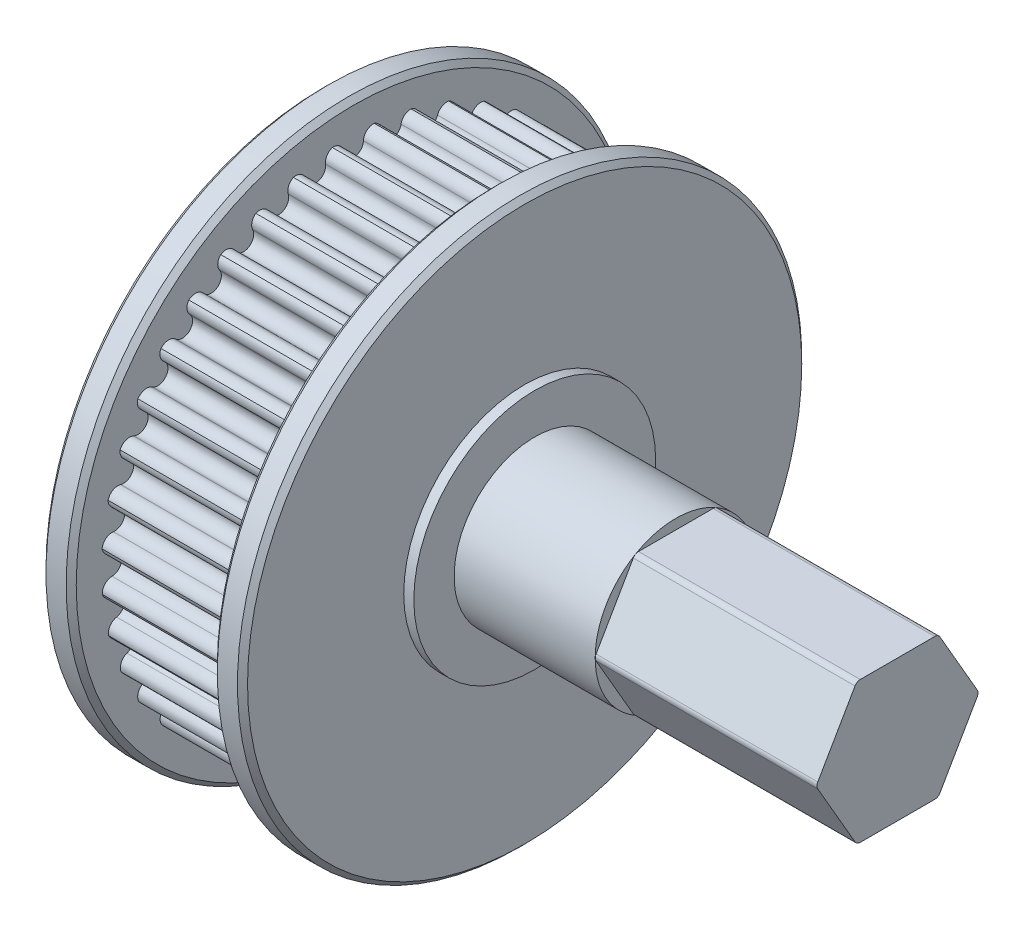
from build123d import *

# Parameters (mm, degrees)
CUT_EXTRUDE1_START       = -16.5
CUT_EXTRUDE1_OUTLINE_R   = 4
CUT_EXTRUDE1_DEPTH       = 9.5
CUT_EXTRUDE1_START_2     = -16.75
CUT_EXTRUDE1_2_OUTLINE_R = 14
CUT_EXTRUDE1_2_DEPTH     = 1
CUT_EXTRUDE1_START_3     = -8.25
CUT_EXTRUDE1_3_OUTLINE_R = 14
CUT_EXTRUDE1_3_DEPTH     = 1
BOSS_EXTRUDE1_START      = -10
SKETCH2_R                = 6.324330015
BOSS_EXTRUDE1_DEPTH      = 10
SKETCH3_R                = 11.125
CUT_EXTRUDE2_DEPTH       = 7
BOSS_EXTRUDE2_START      = 0.5
SKETCH4_R                = 11.125
SKETCH4_R_2              = 9.625
BOSS_EXTRUDE2_DEPTH      = 0.5
SKETCH7_R                = 6
BOSS_EXTRUDE5_DEPTH      = 0.5
SKETCH5_R                = 4
BOSS_EXTRUDE3_DEPTH      = 7
BOSS_EXTRUDE4_DEPTH      = 11


with BuildPart() as part:
    # Cut-Extrude1: read off the stored shape, not the designer's step
    # Cut-Extrude1 outline → Cut-Extrude1 (new body)
    with BuildSketch(Plane(origin=(17, 0, 0), x_dir=(0, 0, -1), z_dir=(1, 0, 0)).offset(CUT_EXTRUDE1_START)):
        with BuildLine():
            ThreePointArc((1.041143378, 12.456565356), (0.66686285, 12.331604355), (0.499748821, 11.974149369))
            ThreePointArc((0.499748821, 11.974149369), (0, 11.489995997), (-0.499748821, 11.974149369))
            ThreePointArc((-0.499748821, 11.974149369), (-0.66686285, 12.331604355), (-1.041143378, 12.456565356))
            ThreePointArc((-1.041143378, 12.456565356), (-1.309730051, 12.245866404), (-1.380507466, 11.9119152))
            ThreePointArc((-1.380507466, 11.9119152), (-1.793941124, 11.349100539), (-2.366765735, 11.748549781))
            ThreePointArc((-2.366765735, 11.748549781), (-2.587740592, 12.075461509), (-2.976961313, 12.140333659))
            ThreePointArc((-2.976961313, 12.140333659), (-3.20928066, 11.890212548), (-3.226945211, 11.54930081))
            ThreePointArc((-3.226945211, 11.54930081), (-3.547245203, 10.928740058), (-4.175505021, 11.233661906))
            ThreePointArc((-4.175505021, 11.233661906), (-4.444899572, 11.521980725), (-4.83947658, 11.525166655))
            ThreePointArc((-4.83947658, 11.525166655), (-5.029808129, 11.241782197), (-4.993924854, 10.902304304))
            ThreePointArc((-4.993924854, 10.902304304), (-5.213204333, 10.239277727), (-5.881429516, 10.442163992))
            ThreePointArc((-5.881429516, 10.442163992), (-6.192610373, 10.684790536), (-6.582827873, 10.626211799))
            ThreePointArc((-6.582827873, 10.626211799), (-6.726485029, 10.31654186), (-6.637937494, 9.986856884))
            ThreePointArc((-6.637937494, 9.986856884), (-6.750797071, 9.297690396), (-7.442533697, 9.393545346))
            ThreePointArc((-7.442533697, 9.393545346), (-7.787838555, 9.584505343), (-8.164088097, 9.465604342))
            ThreePointArc((-8.164088097, 9.465604342), (-8.257533543, 9.137274024), (-8.118502082, 8.825499903))
            ThreePointArc((-8.118502082, 8.825499903), (-8.122162779, 8.127163071), (-8.820377998, 8.113626438))
            ThreePointArc((-8.820377998, 8.113626438), (-9.191304305, 8.248217819), (-9.544321376, 8.071922291))
            ThreePointArc((-9.544321376, 8.071922291), (-9.585254176, 7.733016176), (-9.399162206, 7.446829824))
            ThreePointArc((-9.399162206, 7.446829824), (-9.293533885, 6.756518017), (-9.98103532, 6.633923119))
            ThreePointArc((-9.98103532, 6.633923119), (-10.36844964, 6.708831799), (-10.689541787, 6.479482724))
            ThreePointArc((-10.689541787, 6.479482724), (-10.67695404, 6.138345804), (-10.448383761, 5.88479408))
            ThreePointArc((-10.448383761, 5.88479408), (-10.236067343, 5.219505067), (-10.895926427, 4.990870596))
            ThreePointArc((-10.895926427, 4.990870596), (-11.290289332, 5.004252074), (-11.571550203, 4.727496789))
            ThreePointArc((-11.571550203, 4.727496789), (-11.50575186, 4.392528988), (-11.240331433, 4.177855175))
            ThreePointArc((-11.240331433, 4.177855175), (-10.926554851, 3.55397058), (-11.542523663, 3.224926275))
            ThreePointArc((-11.542523663, 3.224926275), (-11.934124632, 3.176451055), (-12.16862865, 2.859104193))
            ThreePointArc((-12.16862865, 2.859104193), (-12.051239885, 2.53855353), (-11.75550484, 2.368043611))
            ThreePointArc((-11.75550484, 2.368043611), (-11.347994316, 1.800925542), (-11.90490566, 1.379573567))
            ThreePointArc((-11.90490566, 1.379573567), (-12.284102175, 1.270435269), (-12.466075073, 0.920310963))
            ThreePointArc((-12.466075073, 0.920310963), (-12.299986388, 0.622070459), (-11.981218704, 0.499922953))
            ThreePointArc((-11.981218704, 0.499922953), (-11.490008498, 0.00353574), (-11.974149369, -0.499748821))
            ThreePointArc((-11.974149369, -0.499748821), (-12.331604355, -0.66686285), (-12.456565356, -1.041143378))
            ThreePointArc((-12.456565356, -1.041143378), (-12.245866404, -1.309730051), (-11.9119152, -1.380507466))
            ThreePointArc((-11.9119152, -1.380507466), (-11.349100539, -1.793941124), (-11.748549781, -2.366765735))
            ThreePointArc((-11.748549781, -2.366765735), (-12.075461509, -2.587740592), (-12.140333659, -2.976961313))
            ThreePointArc((-12.140333659, -2.976961313), (-11.890212548, -3.20928066), (-11.54930081, -3.226945211))
            ThreePointArc((-11.54930081, -3.226945211), (-10.928740058, -3.547245203), (-11.233661906, -4.175505021))
            ThreePointArc((-11.233661906, -4.175505021), (-11.521980725, -4.444899572), (-11.525166655, -4.83947658))
            ThreePointArc((-11.525166655, -4.83947658), (-11.241782197, -5.029808129), (-10.902304304, -4.993924854))
            ThreePointArc((-10.902304304, -4.993924854), (-10.239277727, -5.213204333), (-10.442163992, -5.881429516))
            ThreePointArc((-10.442163992, -5.881429516), (-10.684790536, -6.192610373), (-10.626211799, -6.582827873))
            ThreePointArc((-10.626211799, -6.582827873), (-10.31654186, -6.726485029), (-9.986856884, -6.637937494))
            ThreePointArc((-9.986856884, -6.637937494), (-9.297690396, -6.750797071), (-9.393545346, -7.442533697))
            ThreePointArc((-9.393545346, -7.442533697), (-9.584505343, -7.787838555), (-9.465604342, -8.164088097))
            ThreePointArc((-9.465604342, -8.164088097), (-9.137274024, -8.257533543), (-8.825499903, -8.118502082))
            ThreePointArc((-8.825499903, -8.118502082), (-8.127163071, -8.122162779), (-8.113626438, -8.820377998))
            ThreePointArc((-8.113626438, -8.820377998), (-8.248217819, -9.191304305), (-8.071922291, -9.544321376))
            ThreePointArc((-8.071922291, -9.544321376), (-7.733016176, -9.585254176), (-7.446829824, -9.399162206))
            ThreePointArc((-7.446829824, -9.399162206), (-6.756518017, -9.293533885), (-6.633923119, -9.98103532))
            ThreePointArc((-6.633923119, -9.98103532), (-6.708831799, -10.36844964), (-6.479482724, -10.689541787))
            ThreePointArc((-6.479482724, -10.689541787), (-6.138345804, -10.67695404), (-5.88479408, -10.448383761))
            ThreePointArc((-5.88479408, -10.448383761), (-5.219505067, -10.236067343), (-4.990870596, -10.895926427))
            ThreePointArc((-4.990870596, -10.895926427), (-5.004252074, -11.290289332), (-4.727496789, -11.571550203))
            ThreePointArc((-4.727496789, -11.571550203), (-4.392528988, -11.50575186), (-4.177855175, -11.240331433))
            ThreePointArc((-4.177855175, -11.240331433), (-3.55397058, -10.926554851), (-3.224926275, -11.542523663))
            ThreePointArc((-3.224926275, -11.542523663), (-3.176451055, -11.934124632), (-2.859104193, -12.16862865))
            ThreePointArc((-2.859104193, -12.16862865), (-2.53855353, -12.051239885), (-2.368043611, -11.75550484))
            ThreePointArc((-2.368043611, -11.75550484), (-1.800925542, -11.347994316), (-1.379573567, -11.90490566))
            ThreePointArc((-1.379573567, -11.90490566), (-1.270435269, -12.284102175), (-0.920310963, -12.466075073))
            ThreePointArc((-0.920310963, -12.466075073), (-0.622070459, -12.299986388), (-0.499922953, -11.981218704))
            ThreePointArc((-0.499922953, -11.981218704), (-0.00353574, -11.490008498), (0.499748821, -11.974149369))
            ThreePointArc((0.499748821, -11.974149369), (0.66686285, -12.331604355), (1.041143378, -12.456565356))
            ThreePointArc((1.041143378, -12.456565356), (1.309730051, -12.245866404), (1.380507466, -11.9119152))
            ThreePointArc((1.380507466, -11.9119152), (1.793941124, -11.349100539), (2.366765735, -11.748549781))
            ThreePointArc((2.366765735, -11.748549781), (2.587740592, -12.075461509), (2.976961313, -12.140333659))
            ThreePointArc((2.976961313, -12.140333659), (3.20928066, -11.890212548), (3.226945211, -11.54930081))
            ThreePointArc((3.226945211, -11.54930081), (3.547245203, -10.928740058), (4.175505021, -11.233661906))
            ThreePointArc((4.175505021, -11.233661906), (4.444899572, -11.521980725), (4.83947658, -11.525166655))
            ThreePointArc((4.83947658, -11.525166655), (5.029808129, -11.241782197), (4.993924854, -10.902304304))
            ThreePointArc((4.993924854, -10.902304304), (5.213204333, -10.239277727), (5.881429516, -10.442163992))
            ThreePointArc((5.881429516, -10.442163992), (6.192610373, -10.684790536), (6.582827873, -10.626211799))
            ThreePointArc((6.582827873, -10.626211799), (6.726485029, -10.31654186), (6.637937494, -9.986856884))
            ThreePointArc((6.637937494, -9.986856884), (6.750797071, -9.297690396), (7.442533697, -9.393545346))
            ThreePointArc((7.442533697, -9.393545346), (7.787838555, -9.584505343), (8.164088097, -9.465604342))
            ThreePointArc((8.164088097, -9.465604342), (8.257533543, -9.137274024), (8.118502082, -8.825499903))
            ThreePointArc((8.118502082, -8.825499903), (8.122162779, -8.127163071), (8.820377998, -8.113626438))
            ThreePointArc((8.820377998, -8.113626438), (9.191304305, -8.248217819), (9.544321376, -8.071922291))
            ThreePointArc((9.544321376, -8.071922291), (9.585254176, -7.733016176), (9.399162206, -7.446829824))
            ThreePointArc((9.399162206, -7.446829824), (9.293533885, -6.756518017), (9.98103532, -6.633923119))
            ThreePointArc((9.98103532, -6.633923119), (10.36844964, -6.708831799), (10.689541787, -6.479482724))
            ThreePointArc((10.689541787, -6.479482724), (10.67695404, -6.138345804), (10.448383761, -5.88479408))
            ThreePointArc((10.448383761, -5.88479408), (10.236067343, -5.219505067), (10.895926427, -4.990870596))
            ThreePointArc((10.895926427, -4.990870596), (11.290289332, -5.004252074), (11.571550203, -4.727496789))
            ThreePointArc((11.571550203, -4.727496789), (11.50575186, -4.392528988), (11.240331433, -4.177855175))
            ThreePointArc((11.240331433, -4.177855175), (10.926554851, -3.55397058), (11.542523663, -3.224926275))
            ThreePointArc((11.542523663, -3.224926275), (11.934124632, -3.176451055), (12.16862865, -2.859104193))
            ThreePointArc((12.16862865, -2.859104193), (12.051239885, -2.53855353), (11.75550484, -2.368043611))
            ThreePointArc((11.75550484, -2.368043611), (11.347994316, -1.800925542), (11.90490566, -1.379573567))
            ThreePointArc((11.90490566, -1.379573567), (12.284102175, -1.270435269), (12.466075073, -0.920310963))
            ThreePointArc((12.466075073, -0.920310963), (12.299986388, -0.622070459), (11.981218704, -0.499922953))
            ThreePointArc((11.981218704, -0.499922953), (11.490008498, -0.00353574), (11.974149369, 0.499748821))
            ThreePointArc((11.974149369, 0.499748821), (12.331604355, 0.66686285), (12.456565356, 1.041143378))
            ThreePointArc((12.456565356, 1.041143378), (12.245866404, 1.309730051), (11.9119152, 1.380507466))
            ThreePointArc((11.9119152, 1.380507466), (11.349100539, 1.793941124), (11.748549781, 2.366765735))
            ThreePointArc((11.748549781, 2.366765735), (12.075461509, 2.587740592), (12.140333659, 2.976961313))
            ThreePointArc((12.140333659, 2.976961313), (11.890212548, 3.20928066), (11.54930081, 3.226945211))
            ThreePointArc((11.54930081, 3.226945211), (10.928740058, 3.547245203), (11.233661906, 4.175505021))
            ThreePointArc((11.233661906, 4.175505021), (11.521980725, 4.444899572), (11.525166655, 4.83947658))
            ThreePointArc((11.525166655, 4.83947658), (11.241782197, 5.029808129), (10.902304304, 4.993924854))
            ThreePointArc((10.902304304, 4.993924854), (10.239277727, 5.213204333), (10.442163992, 5.881429516))
            ThreePointArc((10.442163992, 5.881429516), (10.684790536, 6.192610373), (10.626211799, 6.582827873))
            ThreePointArc((10.626211799, 6.582827873), (10.31654186, 6.726485029), (9.986856884, 6.637937494))
            ThreePointArc((9.986856884, 6.637937494), (9.297690396, 6.750797071), (9.393545346, 7.442533697))
            ThreePointArc((9.393545346, 7.442533697), (9.584505343, 7.787838555), (9.465604342, 8.164088097))
            ThreePointArc((9.465604342, 8.164088097), (9.137274024, 8.257533543), (8.825499903, 8.118502082))
            ThreePointArc((8.825499903, 8.118502082), (8.127163071, 8.122162779), (8.113626438, 8.820377998))
            ThreePointArc((8.113626438, 8.820377998), (8.248217819, 9.191304305), (8.071922291, 9.544321376))
            ThreePointArc((8.071922291, 9.544321376), (7.733016176, 9.585254176), (7.446829824, 9.399162206))
            ThreePointArc((7.446829824, 9.399162206), (6.756518017, 9.293533885), (6.633923119, 9.98103532))
            ThreePointArc((6.633923119, 9.98103532), (6.708831799, 10.36844964), (6.479482724, 10.689541787))
            ThreePointArc((6.479482724, 10.689541787), (6.138345804, 10.67695404), (5.88479408, 10.448383761))
            ThreePointArc((5.88479408, 10.448383761), (5.219505067, 10.236067343), (4.990870596, 10.895926427))
            ThreePointArc((4.990870596, 10.895926427), (5.004252074, 11.290289332), (4.727496789, 11.571550203))
            ThreePointArc((4.727496789, 11.571550203), (4.392528988, 11.50575186), (4.177855175, 11.240331433))
            ThreePointArc((4.177855175, 11.240331433), (3.55397058, 10.926554851), (3.224926275, 11.542523663))
            ThreePointArc((3.224926275, 11.542523663), (3.176451055, 11.934124632), (2.859104193, 12.16862865))
            ThreePointArc((2.859104193, 12.16862865), (2.53855353, 12.051239885), (2.368043611, 11.75550484))
            ThreePointArc((2.368043611, 11.75550484), (1.797431377, 11.34853508), (1.380507466, 11.9119152))
            ThreePointArc((1.380507466, 11.9119152), (1.309730051, 12.245866404), (1.041143378, 12.456565356))
        make_face()
        Circle(CUT_EXTRUDE1_OUTLINE_R, mode=Mode.SUBTRACT)
    extrude(amount=CUT_EXTRUDE1_DEPTH)

    # Cut-Extrude1 2 outline → Cut-Extrude1 2 (add)
    with BuildSketch(Plane(origin=(17, 0, 0), x_dir=(0, 0, -1), z_dir=(1, 0, 0)).offset(CUT_EXTRUDE1_START_2)):
        Circle(CUT_EXTRUDE1_2_OUTLINE_R)
        with BuildLine():
            ThreePointArc((-0.499748821, 11.974149369), (0, 11.489995997), (0.499748821, 11.974149369))
            ThreePointArc((0.499748821, 11.974149369), (0.66686285, 12.331604355), (1.041143378, 12.456565356))
            ThreePointArc((1.041143378, 12.456565356), (1.309730051, 12.245866404), (1.380507466, 11.9119152))
            ThreePointArc((1.380507466, 11.9119152), (1.797431377, 11.34853508), (2.368043611, 11.75550484))
            ThreePointArc((2.368043611, 11.75550484), (2.53855353, 12.051239885), (2.859104193, 12.16862865))
            ThreePointArc((2.859104193, 12.16862865), (3.176451055, 11.934124632), (3.224926275, 11.542523663))
            ThreePointArc((3.224926275, 11.542523663), (3.55397058, 10.926554851), (4.177855175, 11.240331433))
            ThreePointArc((4.177855175, 11.240331433), (4.392528988, 11.50575186), (4.727496789, 11.571550204))
            ThreePointArc((4.727496789, 11.571550204), (5.004252074, 11.290289332), (4.990870596, 10.895926427))
            ThreePointArc((4.990870596, 10.895926427), (5.219505067, 10.236067343), (5.88479408, 10.448383761))
            ThreePointArc((5.88479408, 10.448383761), (6.138345804, 10.67695404), (6.479482724, 10.689541788))
            ThreePointArc((6.479482724, 10.689541788), (6.708831799, 10.36844964), (6.633923119, 9.98103532))
            ThreePointArc((6.633923119, 9.98103532), (6.756518017, 9.293533885), (7.446829824, 9.399162206))
            ThreePointArc((7.446829824, 9.399162206), (7.733016176, 9.585254176), (8.071922291, 9.544321376))
            ThreePointArc((8.071922291, 9.544321376), (8.248217819, 9.191304305), (8.113626438, 8.820377998))
            ThreePointArc((8.113626438, 8.820377998), (8.127163071, 8.122162779), (8.825499903, 8.118502082))
            ThreePointArc((8.825499903, 8.118502082), (9.137274024, 8.257533543), (9.465604342, 8.164088097))
            ThreePointArc((9.465604342, 8.164088097), (9.584505343, 7.787838555), (9.393545346, 7.442533697))
            ThreePointArc((9.393545346, 7.442533697), (9.297690396, 6.750797071), (9.986856884, 6.637937494))
            ThreePointArc((9.986856884, 6.637937494), (10.31654186, 6.726485029), (10.626211799, 6.582827873))
            ThreePointArc((10.626211799, 6.582827873), (10.684790536, 6.192610373), (10.442163992, 5.881429516))
            ThreePointArc((10.442163992, 5.881429516), (10.239277727, 5.213204333), (10.902304304, 4.993924854))
            ThreePointArc((10.902304304, 4.993924854), (11.241782197, 5.029808129), (11.525166655, 4.83947658))
            ThreePointArc((11.525166655, 4.83947658), (11.521980725, 4.444899572), (11.233661906, 4.175505021))
            ThreePointArc((11.233661906, 4.175505021), (10.928740058, 3.547245203), (11.54930081, 3.226945211))
            ThreePointArc((11.54930081, 3.226945211), (11.890212548, 3.20928066), (12.140333659, 2.976961313))
            ThreePointArc((12.140333659, 2.976961313), (12.075461509, 2.587740592), (11.748549781, 2.366765735))
            ThreePointArc((11.748549781, 2.366765735), (11.349100539, 1.793941124), (11.9119152, 1.380507466))
            ThreePointArc((11.9119152, 1.380507466), (12.245866404, 1.309730051), (12.456565356, 1.041143378))
            ThreePointArc((12.456565356, 1.041143378), (12.331604355, 0.66686285), (11.974149369, 0.499748821))
            ThreePointArc((11.974149369, 0.499748821), (11.490008498, -0.00353574), (11.981218704, -0.499922953))
            ThreePointArc((11.981218704, -0.499922953), (12.299986388, -0.622070459), (12.466075073, -0.920310963))
            ThreePointArc((12.466075073, -0.920310963), (12.284102175, -1.270435269), (11.90490566, -1.379573567))
            ThreePointArc((11.90490566, -1.379573567), (11.347994316, -1.800925542), (11.75550484, -2.368043611))
            ThreePointArc((11.75550484, -2.368043611), (12.051239885, -2.53855353), (12.16862865, -2.859104193))
            ThreePointArc((12.16862865, -2.859104193), (11.934124632, -3.176451055), (11.542523663, -3.224926275))
            ThreePointArc((11.542523663, -3.224926275), (10.926554851, -3.55397058), (11.240331433, -4.177855175))
            ThreePointArc((11.240331433, -4.177855175), (11.50575186, -4.392528988), (11.571550204, -4.727496789))
            ThreePointArc((11.571550204, -4.727496789), (11.290289332, -5.004252074), (10.895926427, -4.990870596))
            ThreePointArc((10.895926427, -4.990870596), (10.236067343, -5.219505067), (10.448383761, -5.88479408))
            ThreePointArc((10.448383761, -5.88479408), (10.67695404, -6.138345804), (10.689541788, -6.479482724))
            ThreePointArc((10.689541788, -6.479482724), (10.36844964, -6.708831799), (9.98103532, -6.633923119))
            ThreePointArc((9.98103532, -6.633923119), (9.293533885, -6.756518017), (9.399162206, -7.446829824))
            ThreePointArc((9.399162206, -7.446829824), (9.585254176, -7.733016176), (9.544321376, -8.071922291))
            ThreePointArc((9.544321376, -8.071922291), (9.191304305, -8.248217819), (8.820377998, -8.113626438))
            ThreePointArc((8.820377998, -8.113626438), (8.122162779, -8.127163071), (8.118502082, -8.825499903))
            ThreePointArc((8.118502082, -8.825499903), (8.257533543, -9.137274024), (8.164088097, -9.465604342))
            ThreePointArc((8.164088097, -9.465604342), (7.787838555, -9.584505343), (7.442533697, -9.393545346))
            ThreePointArc((7.442533697, -9.393545346), (6.750797071, -9.297690396), (6.637937494, -9.986856884))
            ThreePointArc((6.637937494, -9.986856884), (6.726485029, -10.31654186), (6.582827873, -10.626211799))
            ThreePointArc((6.582827873, -10.626211799), (6.192610373, -10.684790536), (5.881429516, -10.442163992))
            ThreePointArc((5.881429516, -10.442163992), (5.213204333, -10.239277727), (4.993924854, -10.902304304))
            ThreePointArc((4.993924854, -10.902304304), (5.029808129, -11.241782197), (4.83947658, -11.525166655))
            ThreePointArc((4.83947658, -11.525166655), (4.444899572, -11.521980725), (4.175505021, -11.233661906))
            ThreePointArc((4.175505021, -11.233661906), (3.547245203, -10.928740058), (3.226945211, -11.54930081))
            ThreePointArc((3.226945211, -11.54930081), (3.20928066, -11.890212548), (2.976961313, -12.140333659))
            ThreePointArc((2.976961313, -12.140333659), (2.587740592, -12.075461509), (2.366765735, -11.748549781))
            ThreePointArc((2.366765735, -11.748549781), (1.793941124, -11.349100539), (1.380507466, -11.9119152))
            ThreePointArc((1.380507466, -11.9119152), (1.309730051, -12.245866404), (1.041143378, -12.456565356))
            ThreePointArc((1.041143378, -12.456565356), (0.66686285, -12.331604355), (0.499748821, -11.974149369))
            ThreePointArc((0.499748821, -11.974149369), (-0.00353574, -11.490008498), (-0.499922953, -11.981218704))
            ThreePointArc((-0.499922953, -11.981218704), (-0.622070459, -12.299986388), (-0.920310963, -12.466075073))
            ThreePointArc((-0.920310963, -12.466075073), (-1.270435269, -12.284102175), (-1.379573567, -11.90490566))
            ThreePointArc((-1.379573567, -11.90490566), (-1.800925542, -11.347994316), (-2.368043611, -11.75550484))
            ThreePointArc((-2.368043611, -11.75550484), (-2.53855353, -12.051239885), (-2.859104193, -12.16862865))
            ThreePointArc((-2.859104193, -12.16862865), (-3.176451055, -11.934124632), (-3.224926275, -11.542523663))
            ThreePointArc((-3.224926275, -11.542523663), (-3.55397058, -10.926554851), (-4.177855175, -11.240331433))
            ThreePointArc((-4.177855175, -11.240331433), (-4.392528988, -11.50575186), (-4.727496789, -11.571550204))
            ThreePointArc((-4.727496789, -11.571550204), (-5.004252074, -11.290289332), (-4.990870596, -10.895926427))
            ThreePointArc((-4.990870596, -10.895926427), (-5.219505067, -10.236067343), (-5.88479408, -10.448383761))
            ThreePointArc((-5.88479408, -10.448383761), (-6.138345804, -10.67695404), (-6.479482724, -10.689541788))
            ThreePointArc((-6.479482724, -10.689541788), (-6.708831799, -10.36844964), (-6.633923119, -9.98103532))
            ThreePointArc((-6.633923119, -9.98103532), (-6.756518017, -9.293533885), (-7.446829824, -9.399162206))
            ThreePointArc((-7.446829824, -9.399162206), (-7.733016176, -9.585254176), (-8.071922291, -9.544321376))
            ThreePointArc((-8.071922291, -9.544321376), (-8.248217819, -9.191304305), (-8.113626438, -8.820377998))
            ThreePointArc((-8.113626438, -8.820377998), (-8.127163071, -8.122162779), (-8.825499903, -8.118502082))
            ThreePointArc((-8.825499903, -8.118502082), (-9.137274024, -8.257533543), (-9.465604342, -8.164088097))
            ThreePointArc((-9.465604342, -8.164088097), (-9.584505343, -7.787838555), (-9.393545346, -7.442533697))
            ThreePointArc((-9.393545346, -7.442533697), (-9.297690396, -6.750797071), (-9.986856884, -6.637937494))
            ThreePointArc((-9.986856884, -6.637937494), (-10.31654186, -6.726485029), (-10.626211799, -6.582827873))
            ThreePointArc((-10.626211799, -6.582827873), (-10.684790536, -6.192610373), (-10.442163992, -5.881429516))
            ThreePointArc((-10.442163992, -5.881429516), (-10.239277727, -5.213204333), (-10.902304304, -4.993924854))
            ThreePointArc((-10.902304304, -4.993924854), (-11.241782197, -5.029808129), (-11.525166655, -4.83947658))
            ThreePointArc((-11.525166655, -4.83947658), (-11.521980725, -4.444899572), (-11.233661906, -4.175505021))
            ThreePointArc((-11.233661906, -4.175505021), (-10.928740058, -3.547245203), (-11.54930081, -3.226945211))
            ThreePointArc((-11.54930081, -3.226945211), (-11.890212548, -3.20928066), (-12.140333659, -2.976961313))
            ThreePointArc((-12.140333659, -2.976961313), (-12.075461509, -2.587740592), (-11.748549781, -2.366765735))
            ThreePointArc((-11.748549781, -2.366765735), (-11.349100539, -1.793941124), (-11.9119152, -1.380507466))
            ThreePointArc((-11.9119152, -1.380507466), (-12.245866404, -1.309730051), (-12.456565356, -1.041143378))
            ThreePointArc((-12.456565356, -1.041143378), (-12.331604355, -0.66686285), (-11.974149369, -0.499748821))
            ThreePointArc((-11.974149369, -0.499748821), (-11.490008498, 0.00353574), (-11.981218704, 0.499922953))
            ThreePointArc((-11.981218704, 0.499922953), (-12.299986388, 0.622070459), (-12.466075073, 0.920310963))
            ThreePointArc((-12.466075073, 0.920310963), (-12.284102175, 1.270435269), (-11.90490566, 1.379573567))
            ThreePointArc((-11.90490566, 1.379573567), (-11.347994316, 1.800925542), (-11.75550484, 2.368043611))
            ThreePointArc((-11.75550484, 2.368043611), (-12.051239885, 2.53855353), (-12.16862865, 2.859104193))
            ThreePointArc((-12.16862865, 2.859104193), (-11.934124632, 3.176451055), (-11.542523663, 3.224926275))
            ThreePointArc((-11.542523663, 3.224926275), (-10.926554851, 3.55397058), (-11.240331433, 4.177855175))
            ThreePointArc((-11.240331433, 4.177855175), (-11.50575186, 4.392528988), (-11.571550204, 4.727496789))
            ThreePointArc((-11.571550204, 4.727496789), (-11.290289332, 5.004252074), (-10.895926427, 4.990870596))
            ThreePointArc((-10.895926427, 4.990870596), (-10.236067343, 5.219505067), (-10.448383761, 5.88479408))
            ThreePointArc((-10.448383761, 5.88479408), (-10.67695404, 6.138345804), (-10.689541788, 6.479482724))
            ThreePointArc((-10.689541788, 6.479482724), (-10.36844964, 6.708831799), (-9.98103532, 6.633923119))
            ThreePointArc((-9.98103532, 6.633923119), (-9.293533885, 6.756518017), (-9.399162206, 7.446829824))
            ThreePointArc((-9.399162206, 7.446829824), (-9.585254176, 7.733016176), (-9.544321376, 8.071922291))
            ThreePointArc((-9.544321376, 8.071922291), (-9.191304305, 8.248217819), (-8.820377998, 8.113626438))
            ThreePointArc((-8.820377998, 8.113626438), (-8.122162779, 8.127163071), (-8.118502082, 8.825499903))
            ThreePointArc((-8.118502082, 8.825499903), (-8.257533543, 9.137274024), (-8.164088097, 9.465604342))
            ThreePointArc((-8.164088097, 9.465604342), (-7.787838555, 9.584505343), (-7.442533697, 9.393545346))
            ThreePointArc((-7.442533697, 9.393545346), (-6.750797071, 9.297690396), (-6.637937494, 9.986856884))
            ThreePointArc((-6.637937494, 9.986856884), (-6.726485029, 10.31654186), (-6.582827873, 10.626211799))
            ThreePointArc((-6.582827873, 10.626211799), (-6.192610373, 10.684790536), (-5.881429516, 10.442163992))
            ThreePointArc((-5.881429516, 10.442163992), (-5.213204333, 10.239277727), (-4.993924854, 10.902304304))
            ThreePointArc((-4.993924854, 10.902304304), (-5.029808129, 11.241782197), (-4.83947658, 11.525166655))
            ThreePointArc((-4.83947658, 11.525166655), (-4.444899572, 11.521980725), (-4.175505021, 11.233661906))
            ThreePointArc((-4.175505021, 11.233661906), (-3.547245203, 10.928740058), (-3.226945211, 11.54930081))
            ThreePointArc((-3.226945211, 11.54930081), (-3.20928066, 11.890212548), (-2.976961313, 12.140333659))
            ThreePointArc((-2.976961313, 12.140333659), (-2.587740592, 12.075461509), (-2.366765735, 11.748549781))
            ThreePointArc((-2.366765735, 11.748549781), (-1.793941124, 11.349100539), (-1.380507466, 11.9119152))
            ThreePointArc((-1.380507466, 11.9119152), (-1.309730051, 12.245866404), (-1.041143378, 12.456565356))
            ThreePointArc((-1.041143378, 12.456565356), (-0.66686285, 12.331604355), (-0.499748821, 11.974149369))
        make_face(mode=Mode.SUBTRACT)
    extrude(amount=CUT_EXTRUDE1_2_DEPTH)

    # Cut-Extrude1 3 outline → Cut-Extrude1 3 (add)
    with BuildSketch(Plane(origin=(17, 0, 0), x_dir=(0, 0, -1), z_dir=(1, 0, 0)).offset(CUT_EXTRUDE1_START_3)):
        Circle(CUT_EXTRUDE1_3_OUTLINE_R)
        with BuildLine():
            ThreePointArc((-0.499748821, 11.974149369), (0, 11.489995997), (0.499748821, 11.974149369))
            ThreePointArc((0.499748821, 11.974149369), (0.66686285, 12.331604355), (1.041143378, 12.456565356))
            ThreePointArc((1.041143378, 12.456565356), (1.309730051, 12.245866404), (1.380507466, 11.9119152))
            ThreePointArc((1.380507466, 11.9119152), (1.797431377, 11.34853508), (2.368043611, 11.75550484))
            ThreePointArc((2.368043611, 11.75550484), (2.53855353, 12.051239885), (2.859104193, 12.16862865))
            ThreePointArc((2.859104193, 12.16862865), (3.176451055, 11.934124632), (3.224926275, 11.542523663))
            ThreePointArc((3.224926275, 11.542523663), (3.55397058, 10.926554851), (4.177855175, 11.240331433))
            ThreePointArc((4.177855175, 11.240331433), (4.392528988, 11.50575186), (4.727496789, 11.571550204))
            ThreePointArc((4.727496789, 11.571550204), (5.004252074, 11.290289332), (4.990870596, 10.895926427))
            ThreePointArc((4.990870596, 10.895926427), (5.219505067, 10.236067343), (5.88479408, 10.448383761))
            ThreePointArc((5.88479408, 10.448383761), (6.138345804, 10.67695404), (6.479482724, 10.689541788))
            ThreePointArc((6.479482724, 10.689541788), (6.708831799, 10.36844964), (6.633923119, 9.98103532))
            ThreePointArc((6.633923119, 9.98103532), (6.756518017, 9.293533885), (7.446829824, 9.399162206))
            ThreePointArc((7.446829824, 9.399162206), (7.733016176, 9.585254176), (8.071922291, 9.544321376))
            ThreePointArc((8.071922291, 9.544321376), (8.248217819, 9.191304305), (8.113626438, 8.820377998))
            ThreePointArc((8.113626438, 8.820377998), (8.127163071, 8.122162779), (8.825499903, 8.118502082))
            ThreePointArc((8.825499903, 8.118502082), (9.137274024, 8.257533543), (9.465604342, 8.164088097))
            ThreePointArc((9.465604342, 8.164088097), (9.584505343, 7.787838555), (9.393545346, 7.442533697))
            ThreePointArc((9.393545346, 7.442533697), (9.297690396, 6.750797071), (9.986856884, 6.637937494))
            ThreePointArc((9.986856884, 6.637937494), (10.31654186, 6.726485029), (10.626211799, 6.582827873))
            ThreePointArc((10.626211799, 6.582827873), (10.684790536, 6.192610373), (10.442163992, 5.881429516))
            ThreePointArc((10.442163992, 5.881429516), (10.239277727, 5.213204333), (10.902304304, 4.993924854))
            ThreePointArc((10.902304304, 4.993924854), (11.241782197, 5.029808129), (11.525166655, 4.83947658))
            ThreePointArc((11.525166655, 4.83947658), (11.521980725, 4.444899572), (11.233661906, 4.175505021))
            ThreePointArc((11.233661906, 4.175505021), (10.928740058, 3.547245203), (11.54930081, 3.226945211))
            ThreePointArc((11.54930081, 3.226945211), (11.890212548, 3.20928066), (12.140333659, 2.976961313))
            ThreePointArc((12.140333659, 2.976961313), (12.075461509, 2.587740592), (11.748549781, 2.366765735))
            ThreePointArc((11.748549781, 2.366765735), (11.349100539, 1.793941124), (11.9119152, 1.380507466))
            ThreePointArc((11.9119152, 1.380507466), (12.245866404, 1.309730051), (12.456565356, 1.041143378))
            ThreePointArc((12.456565356, 1.041143378), (12.331604355, 0.66686285), (11.974149369, 0.499748821))
            ThreePointArc((11.974149369, 0.499748821), (11.490008498, -0.00353574), (11.981218704, -0.499922953))
            ThreePointArc((11.981218704, -0.499922953), (12.299986388, -0.622070459), (12.466075073, -0.920310963))
            ThreePointArc((12.466075073, -0.920310963), (12.284102175, -1.270435269), (11.90490566, -1.379573567))
            ThreePointArc((11.90490566, -1.379573567), (11.347994316, -1.800925542), (11.75550484, -2.368043611))
            ThreePointArc((11.75550484, -2.368043611), (12.051239885, -2.53855353), (12.16862865, -2.859104193))
            ThreePointArc((12.16862865, -2.859104193), (11.934124632, -3.176451055), (11.542523663, -3.224926275))
            ThreePointArc((11.542523663, -3.224926275), (10.926554851, -3.55397058), (11.240331433, -4.177855175))
            ThreePointArc((11.240331433, -4.177855175), (11.50575186, -4.392528988), (11.571550204, -4.727496789))
            ThreePointArc((11.571550204, -4.727496789), (11.290289332, -5.004252074), (10.895926427, -4.990870596))
            ThreePointArc((10.895926427, -4.990870596), (10.236067343, -5.219505067), (10.448383761, -5.88479408))
            ThreePointArc((10.448383761, -5.88479408), (10.67695404, -6.138345804), (10.689541788, -6.479482724))
            ThreePointArc((10.689541788, -6.479482724), (10.36844964, -6.708831799), (9.98103532, -6.633923119))
            ThreePointArc((9.98103532, -6.633923119), (9.293533885, -6.756518017), (9.399162206, -7.446829824))
            ThreePointArc((9.399162206, -7.446829824), (9.585254176, -7.733016176), (9.544321376, -8.071922291))
            ThreePointArc((9.544321376, -8.071922291), (9.191304305, -8.248217819), (8.820377998, -8.113626438))
            ThreePointArc((8.820377998, -8.113626438), (8.122162779, -8.127163071), (8.118502082, -8.825499903))
            ThreePointArc((8.118502082, -8.825499903), (8.257533543, -9.137274024), (8.164088097, -9.465604342))
            ThreePointArc((8.164088097, -9.465604342), (7.787838555, -9.584505343), (7.442533697, -9.393545346))
            ThreePointArc((7.442533697, -9.393545346), (6.750797071, -9.297690396), (6.637937494, -9.986856884))
            ThreePointArc((6.637937494, -9.986856884), (6.726485029, -10.31654186), (6.582827873, -10.626211799))
            ThreePointArc((6.582827873, -10.626211799), (6.192610373, -10.684790536), (5.881429516, -10.442163992))
            ThreePointArc((5.881429516, -10.442163992), (5.213204333, -10.239277727), (4.993924854, -10.902304304))
            ThreePointArc((4.993924854, -10.902304304), (5.029808129, -11.241782197), (4.83947658, -11.525166655))
            ThreePointArc((4.83947658, -11.525166655), (4.444899572, -11.521980725), (4.175505021, -11.233661906))
            ThreePointArc((4.175505021, -11.233661906), (3.547245203, -10.928740058), (3.226945211, -11.54930081))
            ThreePointArc((3.226945211, -11.54930081), (3.20928066, -11.890212548), (2.976961313, -12.140333659))
            ThreePointArc((2.976961313, -12.140333659), (2.587740592, -12.075461509), (2.366765735, -11.748549781))
            ThreePointArc((2.366765735, -11.748549781), (1.793941124, -11.349100539), (1.380507466, -11.9119152))
            ThreePointArc((1.380507466, -11.9119152), (1.309730051, -12.245866404), (1.041143378, -12.456565356))
            ThreePointArc((1.041143378, -12.456565356), (0.66686285, -12.331604355), (0.499748821, -11.974149369))
            ThreePointArc((0.499748821, -11.974149369), (-0.00353574, -11.490008498), (-0.499922953, -11.981218704))
            ThreePointArc((-0.499922953, -11.981218704), (-0.622070459, -12.299986388), (-0.920310963, -12.466075073))
            ThreePointArc((-0.920310963, -12.466075073), (-1.270435269, -12.284102175), (-1.379573567, -11.90490566))
            ThreePointArc((-1.379573567, -11.90490566), (-1.800925542, -11.347994316), (-2.368043611, -11.75550484))
            ThreePointArc((-2.368043611, -11.75550484), (-2.53855353, -12.051239885), (-2.859104193, -12.16862865))
            ThreePointArc((-2.859104193, -12.16862865), (-3.176451055, -11.934124632), (-3.224926275, -11.542523663))
            ThreePointArc((-3.224926275, -11.542523663), (-3.55397058, -10.926554851), (-4.177855175, -11.240331433))
            ThreePointArc((-4.177855175, -11.240331433), (-4.392528988, -11.50575186), (-4.727496789, -11.571550204))
            ThreePointArc((-4.727496789, -11.571550204), (-5.004252074, -11.290289332), (-4.990870596, -10.895926427))
            ThreePointArc((-4.990870596, -10.895926427), (-5.219505067, -10.236067343), (-5.88479408, -10.448383761))
            ThreePointArc((-5.88479408, -10.448383761), (-6.138345804, -10.67695404), (-6.479482724, -10.689541788))
            ThreePointArc((-6.479482724, -10.689541788), (-6.708831799, -10.36844964), (-6.633923119, -9.98103532))
            ThreePointArc((-6.633923119, -9.98103532), (-6.756518017, -9.293533885), (-7.446829824, -9.399162206))
            ThreePointArc((-7.446829824, -9.399162206), (-7.733016176, -9.585254176), (-8.071922291, -9.544321376))
            ThreePointArc((-8.071922291, -9.544321376), (-8.248217819, -9.191304305), (-8.113626438, -8.820377998))
            ThreePointArc((-8.113626438, -8.820377998), (-8.127163071, -8.122162779), (-8.825499903, -8.118502082))
            ThreePointArc((-8.825499903, -8.118502082), (-9.137274024, -8.257533543), (-9.465604342, -8.164088097))
            ThreePointArc((-9.465604342, -8.164088097), (-9.584505343, -7.787838555), (-9.393545346, -7.442533697))
            ThreePointArc((-9.393545346, -7.442533697), (-9.297690396, -6.750797071), (-9.986856884, -6.637937494))
            ThreePointArc((-9.986856884, -6.637937494), (-10.31654186, -6.726485029), (-10.626211799, -6.582827873))
            ThreePointArc((-10.626211799, -6.582827873), (-10.684790536, -6.192610373), (-10.442163992, -5.881429516))
            ThreePointArc((-10.442163992, -5.881429516), (-10.239277727, -5.213204333), (-10.902304304, -4.993924854))
            ThreePointArc((-10.902304304, -4.993924854), (-11.241782197, -5.029808129), (-11.525166655, -4.83947658))
            ThreePointArc((-11.525166655, -4.83947658), (-11.521980725, -4.444899572), (-11.233661906, -4.175505021))
            ThreePointArc((-11.233661906, -4.175505021), (-10.928740058, -3.547245203), (-11.54930081, -3.226945211))
            ThreePointArc((-11.54930081, -3.226945211), (-11.890212548, -3.20928066), (-12.140333659, -2.976961313))
            ThreePointArc((-12.140333659, -2.976961313), (-12.075461509, -2.587740592), (-11.748549781, -2.366765735))
            ThreePointArc((-11.748549781, -2.366765735), (-11.349100539, -1.793941124), (-11.9119152, -1.380507466))
            ThreePointArc((-11.9119152, -1.380507466), (-12.245866404, -1.309730051), (-12.456565356, -1.041143378))
            ThreePointArc((-12.456565356, -1.041143378), (-12.331604355, -0.66686285), (-11.974149369, -0.499748821))
            ThreePointArc((-11.974149369, -0.499748821), (-11.490008498, 0.00353574), (-11.981218704, 0.499922953))
            ThreePointArc((-11.981218704, 0.499922953), (-12.299986388, 0.622070459), (-12.466075073, 0.920310963))
            ThreePointArc((-12.466075073, 0.920310963), (-12.284102175, 1.270435269), (-11.90490566, 1.379573567))
            ThreePointArc((-11.90490566, 1.379573567), (-11.347994316, 1.800925542), (-11.75550484, 2.368043611))
            ThreePointArc((-11.75550484, 2.368043611), (-12.051239885, 2.53855353), (-12.16862865, 2.859104193))
            ThreePointArc((-12.16862865, 2.859104193), (-11.934124632, 3.176451055), (-11.542523663, 3.224926275))
            ThreePointArc((-11.542523663, 3.224926275), (-10.926554851, 3.55397058), (-11.240331433, 4.177855175))
            ThreePointArc((-11.240331433, 4.177855175), (-11.50575186, 4.392528988), (-11.571550204, 4.727496789))
            ThreePointArc((-11.571550204, 4.727496789), (-11.290289332, 5.004252074), (-10.895926427, 4.990870596))
            ThreePointArc((-10.895926427, 4.990870596), (-10.236067343, 5.219505067), (-10.448383761, 5.88479408))
            ThreePointArc((-10.448383761, 5.88479408), (-10.67695404, 6.138345804), (-10.689541788, 6.479482724))
            ThreePointArc((-10.689541788, 6.479482724), (-10.36844964, 6.708831799), (-9.98103532, 6.633923119))
            ThreePointArc((-9.98103532, 6.633923119), (-9.293533885, 6.756518017), (-9.399162206, 7.446829824))
            ThreePointArc((-9.399162206, 7.446829824), (-9.585254176, 7.733016176), (-9.544321376, 8.071922291))
            ThreePointArc((-9.544321376, 8.071922291), (-9.191304305, 8.248217819), (-8.820377998, 8.113626438))
            ThreePointArc((-8.820377998, 8.113626438), (-8.122162779, 8.127163071), (-8.118502082, 8.825499903))
            ThreePointArc((-8.118502082, 8.825499903), (-8.257533543, 9.137274024), (-8.164088097, 9.465604342))
            ThreePointArc((-8.164088097, 9.465604342), (-7.787838555, 9.584505343), (-7.442533697, 9.393545346))
            ThreePointArc((-7.442533697, 9.393545346), (-6.750797071, 9.297690396), (-6.637937494, 9.986856884))
            ThreePointArc((-6.637937494, 9.986856884), (-6.726485029, 10.31654186), (-6.582827873, 10.626211799))
            ThreePointArc((-6.582827873, 10.626211799), (-6.192610373, 10.684790536), (-5.881429516, 10.442163992))
            ThreePointArc((-5.881429516, 10.442163992), (-5.213204333, 10.239277727), (-4.993924854, 10.902304304))
            ThreePointArc((-4.993924854, 10.902304304), (-5.029808129, 11.241782197), (-4.83947658, 11.525166655))
            ThreePointArc((-4.83947658, 11.525166655), (-4.444899572, 11.521980725), (-4.175505021, 11.233661906))
            ThreePointArc((-4.175505021, 11.233661906), (-3.547245203, 10.928740058), (-3.226945211, 11.54930081))
            ThreePointArc((-3.226945211, 11.54930081), (-3.20928066, 11.890212548), (-2.976961313, 12.140333659))
            ThreePointArc((-2.976961313, 12.140333659), (-2.587740592, 12.075461509), (-2.366765735, 11.748549781))
            ThreePointArc((-2.366765735, 11.748549781), (-1.793941124, 11.349100539), (-1.380507466, 11.9119152))
            ThreePointArc((-1.380507466, 11.9119152), (-1.309730051, 12.245866404), (-1.041143378, 12.456565356))
            ThreePointArc((-1.041143378, 12.456565356), (-0.66686285, 12.331604355), (-0.499748821, 11.974149369))
        make_face(mode=Mode.SUBTRACT)
    extrude(amount=CUT_EXTRUDE1_3_DEPTH)

    # Cut-Extrude1 4 outline → Cut-Extrude1 4 (revolve)
    with BuildSketch(Plane.YX):
        Polygon((4, 0.5), (4.5, 0), (13.75, 0), (14, 0.25), (12.500000001, 0.25), (12.500000001, 0.5), align=None)
        Polygon((11.489995997, 1.5), (11.489995997, 1.25), (14, 1.25), (13.75, 1.5), align=None)
        Polygon((11.489995997, 8.75), (11.489995997, 8.5), (13.75, 8.5), (14, 8.75), align=None)
        Polygon((11.489995997, 10), (11.489995997, 9.75), (14, 9.75), (13.75, 10), align=None)
    revolve(axis=Axis((0, 0, 0), (1, 0, 0)))

    # Sketch2 → Boss-Extrude1 (add)
    with BuildSketch(Plane(origin=(10, 0, 0), x_dir=(0, 0, -1), z_dir=(1, 0, 0)).offset(BOSS_EXTRUDE1_START)):
        Circle(SKETCH2_R)
    extrude(amount=BOSS_EXTRUDE1_DEPTH)

    # Sketch3 → Cut-Extrude2 (cut)
    with BuildSketch(Plane.ZY):
        Circle(SKETCH3_R)
    extrude(amount=-CUT_EXTRUDE2_DEPTH, mode=Mode.SUBTRACT)

    # Sketch4 → Boss-Extrude2 (add)
    with BuildSketch(Plane.ZY.offset(-7).offset(BOSS_EXTRUDE2_START)):
        Circle(SKETCH4_R)
        Circle(SKETCH4_R_2, mode=Mode.SUBTRACT)
    extrude(amount=-BOSS_EXTRUDE2_DEPTH)

    # Sketch7 → Boss-Extrude5 (add)
    with BuildSketch(Plane(origin=(10, 0, 0), x_dir=(0, 0, -1), z_dir=(1, 0, 0))):
        Circle(SKETCH7_R)
    extrude(amount=BOSS_EXTRUDE5_DEPTH)

    # Sketch5 → Boss-Extrude3 (add)
    with BuildSketch(Plane(origin=(10.5, 0, 0), x_dir=(0, 0, -1), z_dir=(1, 0, 0))):
        Circle(SKETCH5_R)
    extrude(amount=BOSS_EXTRUDE3_DEPTH)

    # Sketch6 → Boss-Extrude4 (add)
    with BuildSketch(Plane(origin=(17.5, 0, 0), x_dir=(0, 0, -1), z_dir=(1, 0, 0))):
        with BuildLine():
            Line((3.954849344, 0.15), (2.107328483, 3.35))
            ThreePointArc((2.107328483, 3.35), (1.997520861, 3.459807621), (1.847520861, 3.5))
            Line((1.847520861, 3.5), (-1.847520861, 3.5))
            ThreePointArc((-1.847520861, 3.5), (-1.997520861, 3.459807621), (-2.107328483, 3.35))
            Line((-2.107328483, 3.35), (-3.954849344, 0.15))
            ThreePointArc((-3.954849344, 0.15), (-3.995041723, 0), (-3.954849344, -0.15))
            Line((-3.954849344, -0.15), (-2.107328483, -3.35))
            ThreePointArc((-2.107328483, -3.35), (-1.997520861, -3.459807621), (-1.847520861, -3.5))
            Line((-1.847520861, -3.5), (1.847520861, -3.5))
            ThreePointArc((1.847520861, -3.5), (1.997520861, -3.459807621), (2.107328483, -3.35))
            Line((2.107328483, -3.35), (3.954849344, -0.15))
            ThreePointArc((3.954849344, -0.15), (3.995041723, 0), (3.954849344, 0.15))
        make_face()
    extrude(amount=BOSS_EXTRUDE4_DEPTH)


solid = part.part
